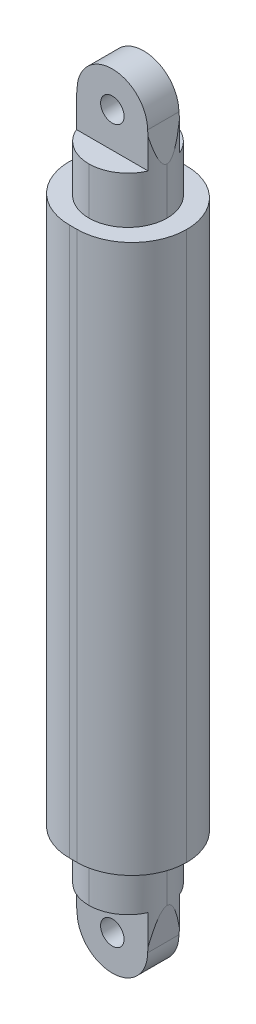
from build123d import *

# Parameters (mm, degrees)
SKETCH2_W                = 10
SKETCH2_H                = 100
BOSS_EXTRUDE1_DEPTH      = 10
FILLET1_R                = 5
CUT_EXTRUDE1_DEPTH       = 3
CUT_EXTRUDE2_START       = 7
SKETCH3_2_W              = 10
SKETCH3_2_H              = 9
CUT_EXTRUDE2_DEPTH       = 3
CUT_EXTRUDE4_START       = -4
CUT_EXTRUDE4_DEPTH       = 56.23475383
SKETCH7_R                = 1.5
CUT_EXTRUDE5_DEPTH       = 51.734603576
BOSS_EXTRUDE2_DEPTH      = 7
BOSS_EXTRUDE2_DEPTH_BACK = 7
SKETCH9_W                = 15
SKETCH9_H                = 70
FILLET3_R                = 7


with BuildPart() as part:
    # Sketch2 → Boss-Extrude1 (new body)
    with BuildSketch(Plane.XY):
        Rectangle(SKETCH2_W, SKETCH2_H)
    extrude(amount=BOSS_EXTRUDE1_DEPTH)

    # Fillet1
    fillet1_edges = [part.edges().sort_by_distance(p)[0] for p in [
        (-5, 0, 0),
        (5, 0, 0),
        (5, 0, 10),
        (-5, 0, 10),
    ]]
    fillet(fillet1_edges, radius=FILLET1_R - 0.0001)  # a hair under: the kernel refuses the full size

    # Sketch3 → Cut-Extrude1 (cut)
    with BuildSketch(Plane.XY):
        with BuildLine():
            Line((-5, -41), (-4.5, -45.5))
            ThreePointArc((-4.5, -45.5), (0, -50), (4.5, -45.5))
            Line((4.5, -45.5), (5, -41))
            Line((5, -41), (-5, -41))
        make_face()
        with BuildLine():
            Line((0, -50), (5, -50))
            Line((5, -50), (5, -41))
            Line((5, -41), (4.5, -45.5))
            ThreePointArc((4.5, -45.5), (3.181980515, -48.681980515), (0, -50))
        make_face()
        with BuildLine():
            Line((-5, -50), (0, -50))
            ThreePointArc((0, -50), (-3.181980515, -48.681980515), (-4.5, -45.5))
            Line((-4.5, -45.5), (-5, -41))
            Line((-5, -41), (-5, -50))
        make_face()
    cut_extrude1 = extrude(amount=CUT_EXTRUDE1_DEPTH, mode=Mode.SUBTRACT)

    # Sketch3<2> → Cut-Extrude2 (cut)
    with BuildSketch(Plane.XY.offset(CUT_EXTRUDE2_START)):
        with Locations((0, -45.5)):
            Rectangle(SKETCH3_2_W, SKETCH3_2_H)
    cut_extrude2 = extrude(amount=CUT_EXTRUDE2_DEPTH, mode=Mode.SUBTRACT)

    # Mirror1: Cut-Extrude1, Cut-Extrude2 across plane
    add(cut_extrude1.mirror(Plane.ZX), mode=Mode.SUBTRACT)
    add(cut_extrude2.mirror(Plane.ZX), mode=Mode.SUBTRACT)

    # Sketch3<4> → Cut-Extrude4 (cut)
    with BuildSketch(Plane.XY.offset(CUT_EXTRUDE4_START)):
        with BuildLine():
            Line((0, -50), (5, -50))
            Line((5, -50), (5, -41))
            Line((5, -41), (4.5, -45.5))
            ThreePointArc((4.5, -45.5), (3.181980515, -48.681980515), (0, -50))
        make_face()
        with BuildLine():
            Line((-5, -50), (0, -50))
            ThreePointArc((0, -50), (-3.181980515, -48.681980515), (-4.5, -45.5))
            Line((-4.5, -45.5), (-5, -41))
            Line((-5, -41), (-5, -50))
        make_face()
    cut_extrude4 = extrude(amount=CUT_EXTRUDE4_DEPTH, mode=Mode.SUBTRACT)

    # Sketch7 → Cut-Extrude5 (cut, through all)
    with BuildSketch(Plane(origin=(0, 0, 3), x_dir=(-1, 0, 0), z_dir=(0, 0, -1))):
        with Locations((0, -45.5)):
            Circle(SKETCH7_R)
    cut_extrude5 = extrude(amount=-CUT_EXTRUDE5_DEPTH, mode=Mode.SUBTRACT)

    # Mirror3: Cut-Extrude5 across plane
    add(cut_extrude5.mirror(Plane.ZX), mode=Mode.SUBTRACT)

    # Mirror4: Cut-Extrude4 across plane
    add(cut_extrude4.mirror(Plane.ZX), mode=Mode.SUBTRACT)

    # Sketch9 → Boss-Extrude2 (add, two sides: drawn at the far end of the back side and taken through both)
    with BuildSketch(Plane.XY.offset(5).offset(-BOSS_EXTRUDE2_DEPTH_BACK)):
        Rectangle(SKETCH9_W, SKETCH9_H)
    extrude(amount=BOSS_EXTRUDE2_DEPTH + BOSS_EXTRUDE2_DEPTH_BACK)

    # Fillet3
    fillet3_edges = [part.edges().sort_by_distance(p)[0] for p in [
        (-7.5, 0, 12),
        (7.5, 0, 12),
        (7.5, 0, -2),
        (-7.5, 0, -2),
    ]]
    fillet(fillet3_edges, radius=FILLET3_R - 0.0001)  # a hair under: the kernel refuses the full size


solid = part.part
